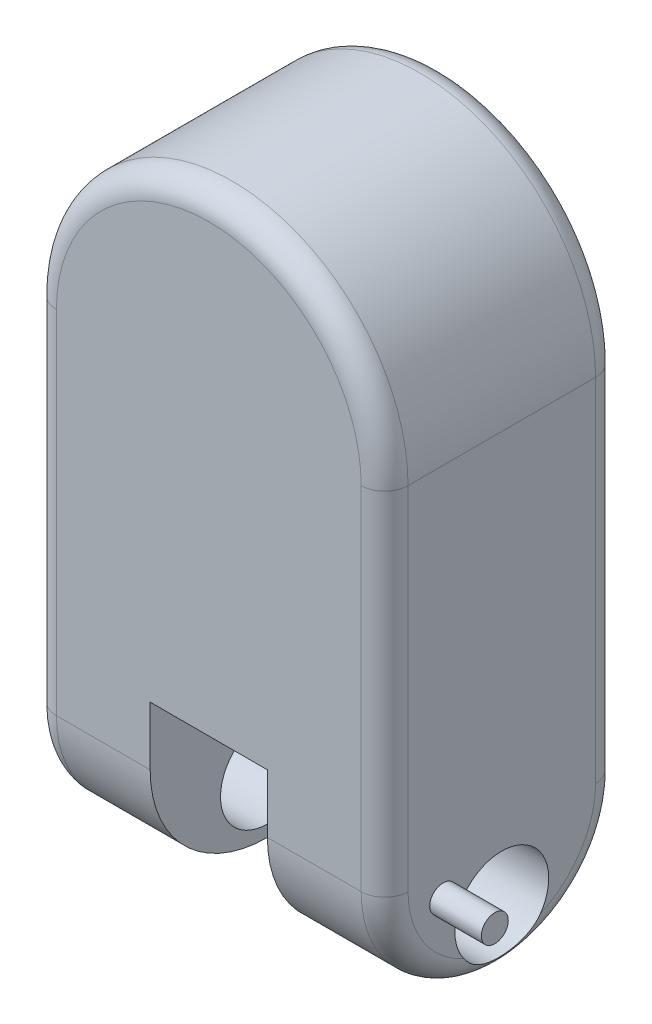
from build123d import *

# Parameters (mm, degrees)
BOSS_EXTRUDE1_DEPTH    = 100
SKETCH2_W              = 50
SKETCH2_H              = 50
CUT_EXTRUDE1_DEPTH     = 161.078105936
CUT_EXTRUDE2_DEPTH     = 25
SKETCH7_R              = 20
CUT_EXTRUDE3_DEPTH     = 207.155281281
FILLET2_R              = 50
CUT_EXTRUDE6_START     = -100
CUT_EXTRUDE6_OUTLINE_W = 50
CUT_EXTRUDE6_OUTLINE_H = 6.698729811
CUT_EXTRUDE6_DEPTH     = 50
CUT_EXTRUDE7_DEPTH     = 25
BOSS_EXTRUDE2_DEPTH    = 100
FILLET4_R              = 10
SKETCH11_W             = 50
SKETCH11_H             = 25
CUT_EXTRUDE11_DEPTH    = 99
SKETCH16_W             = 50
SKETCH16_H             = 30
BOSS_EXTRUDE3_DEPTH    = 0.1
FILLET5_R              = 10
SKETCH17_R             = 5.75
BOSS_EXTRUDE4_DEPTH    = 22


with BuildPart() as part:
    # Sketch1 → Boss-Extrude1 (new body)
    with BuildSketch(Plane.XY):
        Polygon((-75, 100), (0.2, 100), (49.8, 100), (75, 100), (75, -100), (-75, -100), align=None)
    extrude(amount=-BOSS_EXTRUDE1_DEPTH)

    # Sketch2 → Cut-Extrude1 (cut, through all)
    with BuildSketch(Plane.XY):
        with Locations((0, -100)):
            Rectangle(SKETCH2_W, SKETCH2_H)
    extrude(amount=-CUT_EXTRUDE1_DEPTH, mode=Mode.SUBTRACT)

    # Sketch6 → Cut-Extrude2 (cut, symmetric)
    with BuildSketch(Plane(origin=(0, 0, 0), x_dir=(0, 0, -1), z_dir=(1, 0, 0))):
        with BuildLine():
            Line((100, -75), (0, -75))
            ThreePointArc((0, -75), (50, -25), (100, -75))
        make_face()
    extrude(amount=CUT_EXTRUDE2_DEPTH, both=True, mode=Mode.SUBTRACT)

    # Sketch7 → Cut-Extrude3 (cut, through all)
    with BuildSketch(Plane.ZY.offset(75)):
        with Locations(Location((-50, -75, 0), (0, 0, 270))):
            Circle(SKETCH7_R)
    extrude(amount=-CUT_EXTRUDE3_DEPTH, mode=Mode.SUBTRACT)

    # Fillet2
    fillet2_edges = [part.edges().sort_by_distance(p)[0] for p in [
        (-50, -100, -100),
        (-50, -100, 0),
    ]]
    fillet(fillet2_edges, radius=FILLET2_R - 0.0001)  # a hair under: the kernel refuses the full size

    # Cut-Extrude6: read off the stored shape, not the designer's step
    # Cut-Extrude6 outline → Cut-Extrude6 (cut)
    with BuildSketch(Plane(origin=(0, 0, 0), x_dir=(1, 0, 0), z_dir=(0, 1, 0)).offset(CUT_EXTRUDE6_START)):
        with Locations((0, 96.650635095)):
            Rectangle(CUT_EXTRUDE6_OUTLINE_W, CUT_EXTRUDE6_OUTLINE_H)
        with Locations((0, 3.349364906)):
            Rectangle(CUT_EXTRUDE6_OUTLINE_W, CUT_EXTRUDE6_OUTLINE_H)
    extrude(amount=CUT_EXTRUDE6_DEPTH, mode=Mode.SUBTRACT)

    # Sketch10 → Cut-Extrude7 (cut, symmetric)
    with BuildSketch(Plane(origin=(0, 0, 0), x_dir=(0, 0, -1), z_dir=(1, 0, 0))):
        with BuildLine():
            Line((0, -50), (100, -50))
            ThreePointArc((100, -50), (50, -36.602540378), (0, -50))
        make_face()
    extrude(amount=CUT_EXTRUDE7_DEPTH, both=True, mode=Mode.SUBTRACT)

    # Sketch15 → Boss-Extrude2 (add)
    with BuildSketch(Plane.XY):
        with BuildLine():
            Line((-75, 100), (75, 100))
            ThreePointArc((75, 100), (0, 175), (-75, 100))
        make_face()
    extrude(amount=-BOSS_EXTRUDE2_DEPTH)

    # Fillet4
    # the kernel refuses this fillet: 10 mm, written as the material it takes off along each edge
    with BuildSketch(Plane(origin=(0, 100, -100), x_dir=(1, 0, 0), z_dir=(0, -1, 0))) as fillet4_piece_1:
        with BuildLine():
            CenterArc((75 - FILLET4_R, FILLET4_R), FILLET4_R, 270, 90)
            Line((75, FILLET4_R), (75, 0))
            Line((75, 0), (75 - FILLET4_R, 0))
        make_face()
    revolve(axis=Axis((0, 100, -100), (0, 0, 1)), revolution_arc=180, mode=Mode.SUBTRACT)
    with BuildSketch(Plane(origin=(0, 100, 0), x_dir=(1, 0, 0), z_dir=(0, -1, 0))) as fillet4_piece_2:
        with BuildLine():
            CenterArc((75 - FILLET4_R, -FILLET4_R), FILLET4_R, 0, 90)
            Line((75, -FILLET4_R), (75, 0))
            Line((75, 0), (75 - FILLET4_R, 0))
        make_face()
    revolve(axis=Axis((0, 100, 0), (0, 0, 1)), revolution_arc=180, mode=Mode.SUBTRACT)
    with BuildSketch(Plane(origin=(-75, -50.0001, -100), x_dir=(0, 0, 1), z_dir=(0, 1, 0)), Plane(origin=(75, 100, 0), x_dir=(-1, 0, 0), z_dir=(0, -1, 0))) as fillet4_piece_3:
        with BuildLine():
            CenterArc((FILLET4_R, FILLET4_R), FILLET4_R, 180, 90)
            Line((0, FILLET4_R), (0, 0))
            Line((0, 0), (FILLET4_R, 0))
        make_face()
    extrude(amount=150.0001, mode=Mode.SUBTRACT)
    with BuildSketch(Plane(origin=(75, 100, -100), x_dir=(-1, 0, 0), z_dir=(0, -1, 0)), Plane(origin=(-75, -50.0001, 0), x_dir=(0, 0, -1), z_dir=(0, 1, 0))) as fillet4_piece_4:
        with BuildLine():
            CenterArc((FILLET4_R, -FILLET4_R), FILLET4_R, 90, 90)
            Line((0, -FILLET4_R), (0, 0))
            Line((0, 0), (FILLET4_R, 0))
        make_face()
    extrude(amount=150.0001, mode=Mode.SUBTRACT)
    with BuildSketch(Plane(origin=(75, -50.0001, -49.9999), x_dir=(0, 0, 1), z_dir=(0, 1, 0))) as fillet4_piece_5:
        with BuildLine():
            CenterArc((49.9999 - FILLET4_R, -FILLET4_R), FILLET4_R, 0, 90)
            Line((49.9999 - FILLET4_R, 0), (49.9999, 0))
            Line((49.9999, 0), (49.9999, -FILLET4_R))
        make_face()
    revolve(axis=Axis((75, -50.0001, -49.9999), (1, 0, 0)), revolution_arc=90, mode=Mode.SUBTRACT)
    with BuildSketch(Plane(origin=(75, -50.0001, -50.0001), x_dir=(0, 0, -1), z_dir=(0, 1, 0))) as fillet4_piece_6:
        with BuildLine():
            CenterArc((49.9999 - FILLET4_R, FILLET4_R), FILLET4_R, 270, 90)
            Line((49.9999, FILLET4_R), (49.9999, 0))
            Line((49.9999, 0), (49.9999 - FILLET4_R, 0))
        make_face()
    revolve(axis=Axis((75, -50.0001, -50.0001), (-1, 0, 0)), revolution_arc=90, mode=Mode.SUBTRACT)
    with BuildSketch(Plane(origin=(-75, -50.0001, -49.9999), x_dir=(0, 0, 1), z_dir=(0, 1, 0))) as fillet4_piece_7:
        with BuildLine():
            CenterArc((49.9999 - FILLET4_R, FILLET4_R), FILLET4_R, 270, 90)
            Line((49.9999, FILLET4_R), (49.9999, 0))
            Line((49.9999, 0), (49.9999 - FILLET4_R, 0))
        make_face()
    revolve(axis=Axis((-75, -50.0001, -49.9999), (1, 0, 0)), revolution_arc=90, mode=Mode.SUBTRACT)
    with BuildSketch(Plane(origin=(-75, -50.0001, -50.0001), x_dir=(0, 0, -1), z_dir=(0, 1, 0))) as fillet4_piece_8:
        with BuildLine():
            CenterArc((49.9999 - FILLET4_R, -FILLET4_R), FILLET4_R, 0, 90)
            Line((49.9999, -FILLET4_R), (49.9999, 0))
            Line((49.9999, 0), (49.9999 - FILLET4_R, 0))
        make_face()
    revolve(axis=Axis((-75, -50.0001, -50.0001), (-1, 0, 0)), revolution_arc=90, mode=Mode.SUBTRACT)
    with BuildSketch(Plane(origin=(-75, -100, -49.9999), x_dir=(0, 1, 0), z_dir=(0, 0, -1))) as fillet4_piece_9:
        with BuildLine():
            CenterArc((FILLET4_R, FILLET4_R), FILLET4_R, 180, 90)
            Line((0, FILLET4_R), (0, 0))
            Line((0, 0), (FILLET4_R, 0))
        make_face()
    extrude(amount=0.0002, mode=Mode.SUBTRACT)
    with BuildSketch(Plane(origin=(75, -100, -49.9999), x_dir=(0, 1, 0), z_dir=(0, 0, -1))) as fillet4_piece_10:
        with BuildLine():
            CenterArc((FILLET4_R, -FILLET4_R), FILLET4_R, 90, 90)
            Line((0, -FILLET4_R), (0, 0))
            Line((0, 0), (FILLET4_R, 0))
        make_face()
    extrude(amount=0.0002, mode=Mode.SUBTRACT)

    # Sketch11 → Cut-Extrude11 (cut)
    with BuildSketch(Plane.XY):
        with Locations((0, -37.5)):
            Rectangle(SKETCH11_W, SKETCH11_H)
    extrude(amount=-CUT_EXTRUDE11_DEPTH, mode=Mode.SUBTRACT)

    # Sketch17 → Boss-Extrude4 (add)
    with BuildSketch(Plane(origin=(75, 0, 0), x_dir=(0, 0, -1), z_dir=(1, 0, 0))):
        with Locations(Location((25, -60, 0), (0, 0, 90))):
            Circle(SKETCH17_R)
    extrude(amount=BOSS_EXTRUDE4_DEPTH)


with BuildPart() as body_2:
    # Sketch16 → Boss-Extrude3 (new body)
    with BuildSketch(Plane(origin=(0, 0, -100), x_dir=(-1, 0, 0), z_dir=(0, 0, -1))):
        with Locations((0, -65)):
            Rectangle(SKETCH16_W, SKETCH16_H)
    extrude(amount=BOSS_EXTRUDE3_DEPTH)

    # Fillet5
    # the kernel refuses this fillet: 10 mm, written as the material it takes off along each edge
    with BuildSketch(Plane(origin=(25, -46.473316005, -100.1), x_dir=(0, 0, 1), z_dir=(0, -1, 0)), Plane(origin=(-25, -83.526683995, -100.1), x_dir=(0, 0, 1), z_dir=(0, 1, 0))) as fillet5_piece_1:
        with BuildLine():
            CenterArc((10, 1.410673598), FILLET5_R, 180, 8.109614456)
            Line((0, 1.410673598), (0, 0))
            Line((0, 0), (0.1, 0))
        make_face()
    extrude(amount=37.05336799, mode=Mode.SUBTRACT)
    with BuildSketch(Plane(origin=(28.526683995, -80, -100.1), x_dir=(0, 0, 1), z_dir=(-1, 0, 0))) as fillet5_piece_2:
        with BuildLine():
            CenterArc((10, 1.410673598), FILLET5_R, 180, 8.109614456)
            Line((0, 1.410673598), (0, 0))
            Line((0, 0), (0.1, 0))
        make_face()
    extrude(amount=57.05336799, mode=Mode.SUBTRACT)


solid = Compound([part.part, body_2.part])
